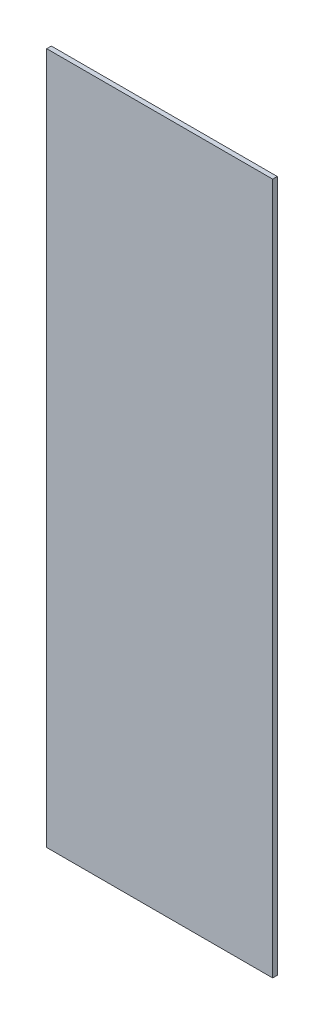
from build123d import *

# Parameters (mm, degrees)
SKETCH1_W           = 98
SKETCH1_H           = 300
BOSS_EXTRUDE1_DEPTH = 2


with BuildPart() as part:
    # Sketch1 → Boss-Extrude1 (new body)
    with BuildSketch(Plane.XY):
        Rectangle(SKETCH1_W, SKETCH1_H)
    extrude(amount=BOSS_EXTRUDE1_DEPTH)


solid = part.part
